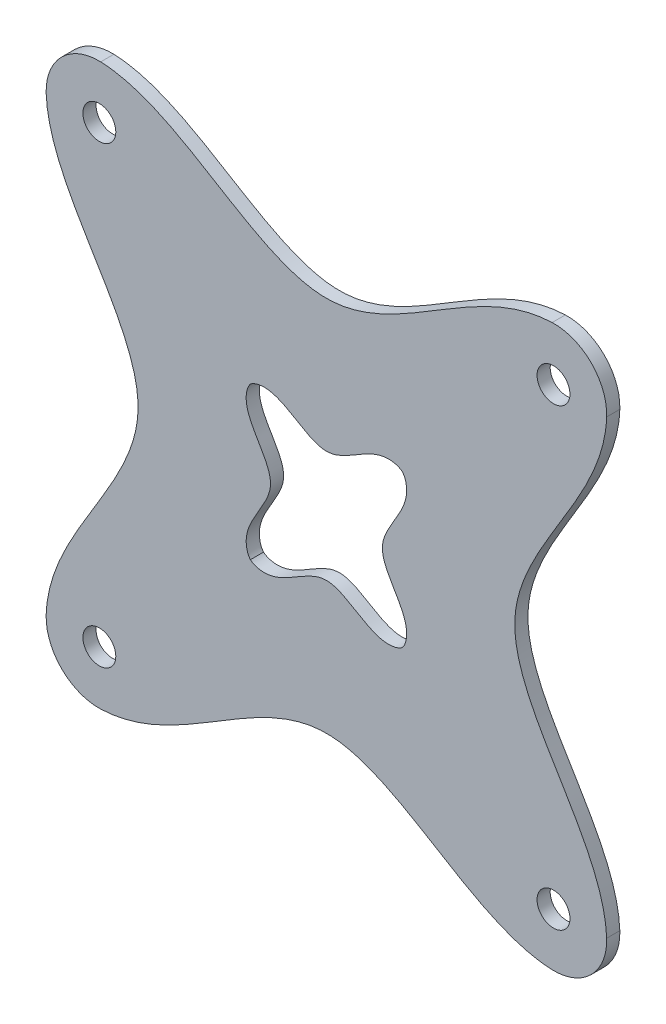
from build123d import *

# Parameters (mm, degrees)
BOSS_EXTRUDE1_DEPTH = 1.27
FILLET1_START       = -1
FILLET1_DEPTH       = 3
FILLET2_START       = -1
FILLET2_DEPTH       = 3
FILLET3_R           = 5.08
FILLET4_R           = 5.08
SKETCH3_R           = 1.5875
CUT_EXTRUDE1_DEPTH  = 39.269062151


with BuildPart() as part:
    # Sketch1 → Boss-Extrude1 (new body)
    with BuildSketch(Plane.XY):
        with BuildLine():
            add(Edge.make_bspline(
                [(-26.078451224, -26.078451224), (-25.595030672, -26.46689269), (-16.201372292, -29.50543677), (0, -7.636650328), (16.201372291, -29.50543677), (25.595030672, -26.46689269), (26.078451224, -26.078451224)],
                knots=[0.032766754, 0.032766754, 0.032766754, 0.032766754, 0.065533508, 0.5, 0.934466492, 0.967233246, 0.967233246, 0.967233246, 0.967233246], degree=3))
            add(Edge.make_bspline(
                [(26.078451224, -26.078451224), (26.46689269, -25.595030672), (29.505436772, -16.201372289), (7.636650328, -2e-09), (29.505436768, 16.201372294), (26.46689269, 25.595030672), (26.078451224, 26.078451224)],
                knots=[0.032766754, 0.032766754, 0.032766754, 0.032766754, 0.065533508, 0.5, 0.934466492, 0.967233246, 0.967233246, 0.967233246, 0.967233246], degree=3))
            add(Edge.make_bspline(
                [(-26.078451224, 26.078451224), (-25.595030672, 26.46689269), (-16.201372292, 29.50543677), (0, 7.636650328), (16.201372291, 29.50543677), (25.595030672, 26.46689269), (26.078451224, 26.078451224)],
                knots=[0.032766754, 0.032766754, 0.032766754, 0.032766754, 0.065533508, 0.5, 0.934466492, 0.967233246, 0.967233246, 0.967233246, 0.967233246], degree=3))
            add(Edge.make_bspline(
                [(-26.078451224, -26.078451224), (-26.46689269, -25.595030672), (-29.50543677, -16.201372292), (-7.636650328, 0), (-29.50543677, 16.201372291), (-26.46689269, 25.595030672), (-26.078451224, 26.078451224)],
                knots=[0.032766754, 0.032766754, 0.032766754, 0.032766754, 0.065533508, 0.5, 0.934466492, 0.967233246, 0.967233246, 0.967233246, 0.967233246], degree=3))
        make_face()
    extrude(amount=BOSS_EXTRUDE1_DEPTH)

    # Fillet1: read off the stored shape, not the designer's step
    # Fillet1 outline → Fillet1 (cut)
    with BuildSketch(Plane.XY.offset(FILLET1_START)):
        with BuildLine():
            add(Edge.make_bspline(
                [(26.078451224, 26.078451224), (25.595030672, 26.46689269), (24.088787806, 26.954113447), (22.608220096, 27.071858625), (21.782533291, 27.042115453)],
                knots=[0.032766754, 0.032766754, 0.032766754, 0.032766754, 0.065533508, 0.1076861, 0.1076861, 0.1076861, 0.1076861], degree=3))
            ThreePointArc((21.782533291, 27.042115453), (25.557510624, 25.557510623), (27.042115452, 21.78253329))
            add(Edge.make_bspline(
                [(27.042115452, 21.78253329), (27.071858625, 22.608220095), (26.954113447, 24.088787806), (26.46689269, 25.595030672), (26.078451224, 26.078451224)],
                knots=[0.8923139, 0.8923139, 0.8923139, 0.8923139, 0.934466492, 0.967233246, 0.967233246, 0.967233246, 0.967233246], degree=3))
        make_face()
    extrude(amount=FILLET1_DEPTH, mode=Mode.SUBTRACT)

    # Fillet2: read off the stored shape, not the designer's step
    # Fillet2 outline → Fillet2 (cut)
    with BuildSketch(Plane.XY.offset(FILLET2_START)):
        with BuildLine():
            add(Edge.make_bspline(
                [(-26.078451224, -26.078451224), (-25.595030672, -26.46689269), (-24.088787806, -26.954113447), (-22.608220096, -27.071858625), (-21.782533291, -27.042115453)],
                knots=[0.032766754, 0.032766754, 0.032766754, 0.032766754, 0.065533508, 0.1076861, 0.1076861, 0.1076861, 0.1076861], degree=3))
            ThreePointArc((-21.782533291, -27.042115453), (-25.557510624, -25.557510624), (-27.042115453, -21.782533291))
            add(Edge.make_bspline(
                [(-27.042115453, -21.782533291), (-27.071858625, -22.608220096), (-26.954113447, -24.088787806), (-26.46689269, -25.595030672), (-26.078451224, -26.078451224)],
                knots=[0.8923139, 0.8923139, 0.8923139, 0.8923139, 0.934466492, 0.967233246, 0.967233246, 0.967233246, 0.967233246], degree=3))
        make_face()
    extrude(amount=FILLET2_DEPTH, mode=Mode.SUBTRACT)

    # Fillet3
    fillet3_edges = [part.edges().sort_by_distance(p)[0] for p in [
        (-26.078451224, 26.078451224, 0.635),
    ]]
    fillet(fillet3_edges, radius=FILLET3_R)

    # Fillet4
    fillet4_edges = [part.edges().sort_by_distance(p)[0] for p in [
        (26.078451224, -26.078451224, 0.635),
    ]]
    fillet(fillet4_edges, radius=FILLET4_R)

    # Sketch3 → Cut-Extrude1 (cut, through all)
    with BuildSketch(Plane.XY.offset(1.27)):
        with Locations((-21.911824935, 21.911824935)):
            Circle(SKETCH3_R)
        with Locations((21.911824935, 21.911824935)):
            Circle(SKETCH3_R)
        with Locations((21.911824935, -21.911824935)):
            Circle(SKETCH3_R)
        with Locations((-21.911824935, -21.911824935)):
            Circle(SKETCH3_R)
        with BuildLine():
            add(Edge.make_bspline(
                [(-7.336925612, -7.336925612), (-7.094564954, -7.539990493), (-4.441685448, -8.467510629), (0, -2.70941912), (4.441685448, -8.467510629), (7.094564954, -7.539990493), (7.336925612, -7.336925612)],
                knots=[0.055321023, 0.055321023, 0.055321023, 0.055321023, 0.110642047, 0.5, 0.889357953, 0.944678976, 0.944678976, 0.944678976, 0.944678976], degree=3))
            add(Edge.make_bspline(
                [(7.336925612, 7.336925612), (7.539990493, 7.094564954), (8.467510629, 4.441685448), (2.70941912, 0), (8.467510629, -4.441685448), (7.539990493, -7.094564954), (7.336925612, -7.336925612)],
                knots=[0.055321023, 0.055321023, 0.055321023, 0.055321023, 0.110642047, 0.5, 0.889357953, 0.944678977, 0.944678977, 0.944678977, 0.944678977], degree=3))
            add(Edge.make_bspline(
                [(-7.336925612, 7.336925612), (-7.094564954, 7.539990493), (-4.441685448, 8.467510629), (0, 2.70941912), (4.441685448, 8.467510629), (7.094564954, 7.539990493), (7.336925612, 7.336925612)],
                knots=[0.055321023, 0.055321023, 0.055321023, 0.055321023, 0.110642047, 0.5, 0.889357953, 0.944678977, 0.944678977, 0.944678977, 0.944678977], degree=3))
            add(Edge.make_bspline(
                [(-7.336925612, 7.336925612), (-7.539990493, 7.094564954), (-8.467510629, 4.441685448), (-2.70941912, 0), (-8.467510629, -4.441685448), (-7.539990493, -7.094564954), (-7.336925612, -7.336925612)],
                knots=[0.055321023, 0.055321023, 0.055321023, 0.055321023, 0.110642047, 0.5, 0.889357953, 0.944678977, 0.944678977, 0.944678977, 0.944678977], degree=3))
        make_face()
    extrude(amount=-CUT_EXTRUDE1_DEPTH, mode=Mode.SUBTRACT)


solid = part.part
